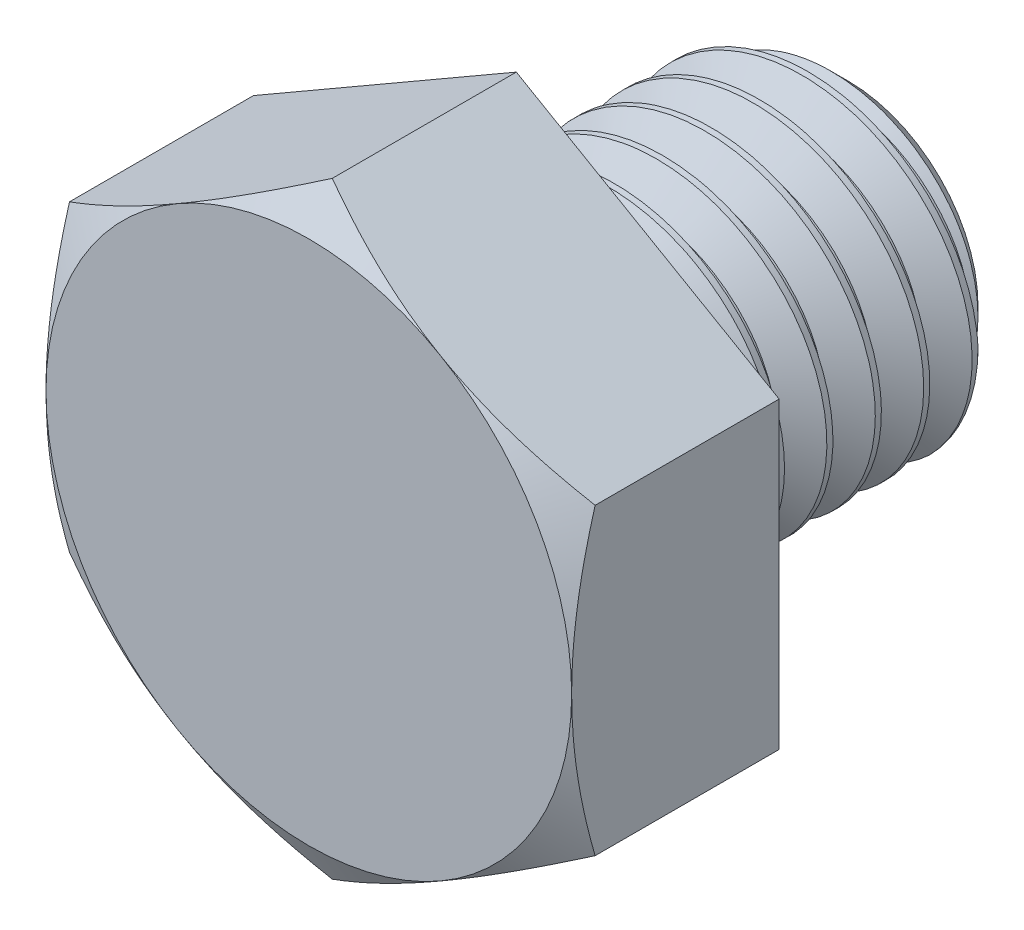
from build123d import *

# Parameters (mm, degrees)
BOSS_EXTRUDE1_DEPTH = 7.5
SKETCH4_OUTSIDE_W   = 115.66
SKETCH4_OUTSIDE_H   = 118.6
SKETCH4_OUTSIDE_R   = 9.5
CUT_EXTRUDE1_DEPTH  = 25.307063445
CUT_EXTRUDE1_DRAFT  = -60
CUT_SWEEP1_PITCH    = 1.75
CUT_SWEEP1_TO       = 12
SKETCH8_R           = 6
BOSS_EXTRUDE2_DEPTH = 12
BOSS_EXTRUDE2_TAPER = 20


with BuildPart() as part:
    # Sketch2 → Revolve1 (revolve)
    with BuildSketch(Plane(origin=(0, 0, 0), x_dir=(0, 0, -1), z_dir=(1, 0, 0)), mode=Mode.PRIVATE) as revolve1_sk:
        Polygon((-9.75, 9.5), (-9.75, 0), (9.75, 0), (9.75, 4.6875), (8.4375, 6), (-2.25, 6), (-2.25, 9.5), align=None)
    revolve(revolve1_sk.sketch.rotate(Axis((0, 0, 9.75), (0, 0, -1)), 90), axis=Axis((0, 0, 9.75), (0, 0, -1)))

    # Sketch3 → Boss-Extrude1 (add)
    with BuildSketch(Plane.XY.offset(9.75)):
        Polygon((0, 10.969655115), (-9.5, 5.484827557), (-9.5, -5.484827557), (0, -10.969655115), (9.5, -5.484827557), (9.5, 5.484827557), align=None)
    extrude(amount=-BOSS_EXTRUDE1_DEPTH)


with BuildPart() as cut_extrude1_tool:
    # Sketch4 outside → Cut-Extrude1 (with draft: the straight prism first)
    with BuildSketch(Plane.XY.offset(9.75)):
        Rectangle(SKETCH4_OUTSIDE_W, SKETCH4_OUTSIDE_H)
        Circle(SKETCH4_OUTSIDE_R, mode=Mode.SUBTRACT)
    extrude(amount=-CUT_EXTRUDE1_DEPTH)
    # Cut-Extrude1: the draft: its side faces are tilted about the plane it starts from
    cut_extrude1_sides = [cut_extrude1_tool.faces().sort_by_distance(p)[0] for p in [
        (0, -59.3, -2.903531723),
        (57.83, 0, -2.903531723),
        (0, 59.3, -2.903531723),
        (-57.83, 0, -2.903531723),
        (-9.5, 0, -2.903531723),
    ]]
    draft(cut_extrude1_sides, Plane.XY.offset(9.75), CUT_EXTRUDE1_DRAFT)


with BuildPart() as part_1:
    add(part.part)

    # Cut-Extrude1: cut by cut_extrude1_tool
    add(cut_extrude1_tool.part, mode=Mode.SUBTRACT)


with BuildPart() as body_2:
    # Split1: read off the stored shape, not the designer's step
    # Split1: the piece on the far side of the plane
    add(part_1.part)
    split(bisect_by=Plane.XY.offset(2.25), keep=Keep.BOTTOM)

    # Cut-Sweep1: arcs per turn and ends read off the stored shape
    # Cut-Sweep1: the profile of Sketch7 screwed along a right-hand helix through 7.857143 turns, 10 arcs to a turn; built about Z, then put on its axis
    cut_sweep1_z = Axis((0, 0, 0), (0, 0, 1))
    cut_sweep1_corners = [(6.094721529, 0, 0.0546875), (4.863341658, 0, -0.65625), (4.863341658, 0, -0.875), (6.094721529, 0, -1.5859375)]
    with BuildLine(mode=Mode.PRIVATE) as cut_sweep1_profile:
        Line(cut_sweep1_corners[0], cut_sweep1_corners[1])
        Line(cut_sweep1_corners[1], cut_sweep1_corners[2])
        Line(cut_sweep1_corners[2], cut_sweep1_corners[3])
        Line(cut_sweep1_corners[3], cut_sweep1_corners[0])
    cut_sweep1_cap = Face(cut_sweep1_profile.wire())
    cut_sweep1_turn_angles = [0, 18, 36, 54, 72, 90, 108, 126, 144, 162, 180, 198, 216, 234, 252, 270, 288, 306, 324, 342, 360]
    cut_sweep1_turn_weights = [1, 0.9510565162951535, 1, 0.9510565162951535, 1, 0.9510565162951535, 1, 0.9510565162951535, 1, 0.9510565162951535, 1, 0.9510565162951535, 1, 0.9510565162951535, 1, 0.9510565162951535, 1, 0.9510565162951535, 1, 0.9510565162951535, 1]
    cut_sweep1_turn_rails = [Edge.make_bspline([Vector(p[0], p[1], 0).rotate(cut_sweep1_z, cut_sweep1_turn_angles[k]) / cut_sweep1_turn_weights[k] + Vector(0, 0, p[2] + CUT_SWEEP1_PITCH * cut_sweep1_turn_angles[k] / 360) for k in range(21)], [0, 0, 0, 1, 1, 2, 2, 3, 3, 4, 4, 5, 5, 6, 6, 7, 7, 8, 8, 9, 9, 10, 10, 10], 2, cut_sweep1_turn_weights) for p in cut_sweep1_corners]
    cut_sweep1_turn_sides = [Face.make_surface_from_curves(cut_sweep1_turn_rails[p[0]], cut_sweep1_turn_rails[p[1]]) for p in [(0, 1), (1, 2), (2, 3), (3, 0)]]
    cut_sweep1_last_angles = [2520, 2538, 2556, 2574, 2592, 2610, 2628, 2646, 2664, 2682, 2700, 2718, 2736, 2754, 2772, 2790, 2808, 2818.285714286, 2828.571428571]
    cut_sweep1_last_weights = [1, 0.9510565162951535, 1, 0.9510565162951535, 1, 0.9510565162951535, 1, 0.9510565162951535, 1, 0.9510565162951535, 1, 0.9510565162951535, 1, 0.9510565162951535, 1, 0.9510565162951535, 1, 0.9839295885985994, 1]
    cut_sweep1_last_rails = [Edge.make_bspline([Vector(p[0], p[1], 0).rotate(cut_sweep1_z, cut_sweep1_last_angles[k]) / cut_sweep1_last_weights[k] + Vector(0, 0, p[2] + CUT_SWEEP1_PITCH * cut_sweep1_last_angles[k] / 360) for k in range(19)], [0, 0, 0, 1, 1, 2, 2, 3, 3, 4, 4, 5, 5, 6, 6, 7, 7, 8, 8, 9, 9, 9], 2, cut_sweep1_last_weights) for p in cut_sweep1_corners]
    cut_sweep1_last_sides = [Face.make_surface_from_curves(cut_sweep1_last_rails[p[0]], cut_sweep1_last_rails[p[1]]) for p in [(0, 1), (1, 2), (2, 3), (3, 0)]]
    cut_sweep1 = Plane(origin=(0, 0, -9.75), x_dir=(0, 1, 0), z_dir=(0, 0, 1)) * split(Solid(Shell([*[p.moved(Location((0, 0, CUT_SWEEP1_PITCH * i))) for i in range(7) for p in cut_sweep1_turn_sides], *cut_sweep1_last_sides, cut_sweep1_cap, cut_sweep1_cap.rotate(cut_sweep1_z, 2828.571428571).moved(Location((0, 0, CUT_SWEEP1_PITCH * 2828.571428571 / 360)))])), bisect_by=Plane.XY.offset(CUT_SWEEP1_TO), keep=Keep.BOTTOM, mode=Mode.PRIVATE)
    add(cut_sweep1, mode=Mode.SUBTRACT)


with BuildPart() as part_2:
    add(part_1.part)

    # Split1
    split(bisect_by=Plane.XY.offset(2.25), keep=Keep.TOP)

    add(body_2.part)  # Boss-Extrude2 merges body 2
    # Sketch8 → Boss-Extrude2 (add)
    with BuildSketch(Plane(origin=(0, 0, 2.25), x_dir=(-1, 0, 0), z_dir=(0, 0, -1))):
        Circle(SKETCH8_R)
    extrude(amount=BOSS_EXTRUDE2_DEPTH, taper=BOSS_EXTRUDE2_TAPER)


solid = part_2.part
